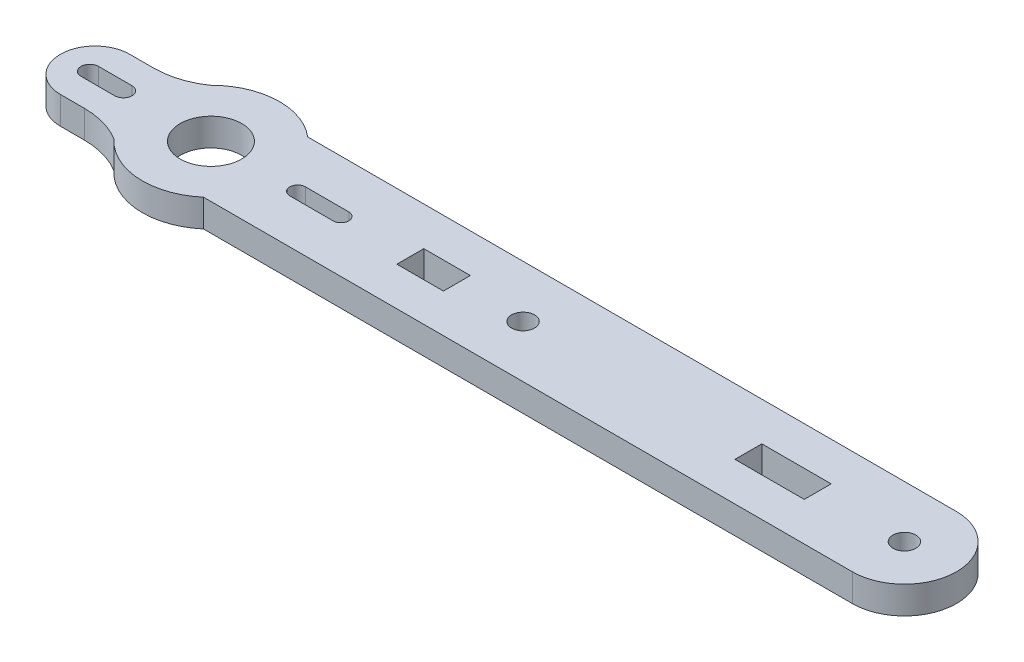
from build123d import *

# Parameters (mm, degrees)
SKETCH1_R           = 1.322622219
SKETCH1_R_2         = 3.543581518
SKETCH1_W           = 5.363642664
SKETCH1_H           = 3.09972609
BOSS_EXTRUDE1_DEPTH = 3.175


with BuildPart() as part:
    # Sketch1 → Boss-Extrude1 (new body)
    with BuildSketch(Plane(origin=(0, 0, 0), x_dir=(1, 0, 0), z_dir=(0, 1, 0))):
        with BuildLine():
            Line((-30.420224954, 6.394505262), (44.302185909, 6.390032423))
            ThreePointArc((44.302185909, 6.390032423), (50.304735151, 0.387483181), (44.302185909, -5.61506606))
            Line((44.302185909, -5.61506606), (-30.420308604, -5.61506606))
            ThreePointArc((-30.420308604, -5.61506606), (-36.033562007, -7.500021548), (-41.380965097, -4.957001462))
            ThreePointArc((-41.380965097, -4.957001462), (-43.672708861, -3.953506377), (-46.150888165, -3.610404055))
            Line((-46.150888165, -3.610404055), (-48.909665253, -3.610404055))
            ThreePointArc((-48.909665253, -3.610404055), (-52.90984424, 0.389774933), (-48.909665253, 4.38995392))
            Line((-48.909665253, 4.38995392), (-46.150888165, 4.38995392))
            ThreePointArc((-46.150888165, 4.38995392), (-43.564402624, 4.780712621), (-41.208786399, 5.918109658))
            ThreePointArc((-41.208786399, 5.918109658), (-35.908549497, 8.286044856), (-30.420224954, 6.394505262))
        make_face()
        with Locations((44.302185909, 0.387483181)):
            Circle(SKETCH1_R, mode=Mode.SUBTRACT)
        with Locations((0.383109325, 0.385153592)):
            Circle(SKETCH1_R, mode=Mode.SUBTRACT)
        with Locations((-35.559869313, 0.389755399)):
            Circle(SKETCH1_R_2, mode=Mode.SUBTRACT)
        Polygon((34.320012777, 1.885218269), (34.320012777, 1.935143597), (26.334122715, 1.935143597), (26.334122715, 1.885218269), (26.334122715, -1.114852491), (26.334122715, -1.164973144), (34.320012777, -1.164973144), (34.320012777, -1.114852491), align=None, mode=Mode.SUBTRACT)
        with Locations((-9.914943428, 0.385085228)):
            Rectangle(SKETCH1_W, SKETCH1_H, mode=Mode.SUBTRACT)
        with BuildLine():
            Line((-20.582664571, -0.514889121), (-25.573840985, -0.514889121))
            ThreePointArc((-25.573840985, -0.514889121), (-26.473815335, 0.385085229), (-25.573840985, 1.285059578))
            Line((-25.573840985, 1.285059578), (-20.582664571, 1.285059578))
            ThreePointArc((-20.582664571, 1.285059578), (-19.682690221, 0.385085229), (-20.582664571, -0.514889121))
        make_face(mode=Mode.SUBTRACT)
        with BuildLine():
            Line((-49.512218616, 1.385222757), (-45.638080248, 1.385222757))
            ThreePointArc((-45.638080248, 1.385222757), (-44.638040384, 0.385182893), (-45.638080248, -0.614856971))
            Line((-45.638080248, -0.614856971), (-49.512218616, -0.614856971))
            ThreePointArc((-49.512218616, -0.614856971), (-50.51225848, 0.385182893), (-49.512218616, 1.385222757))
        make_face(mode=Mode.SUBTRACT)
    extrude(amount=BOSS_EXTRUDE1_DEPTH)


solid = part.part
